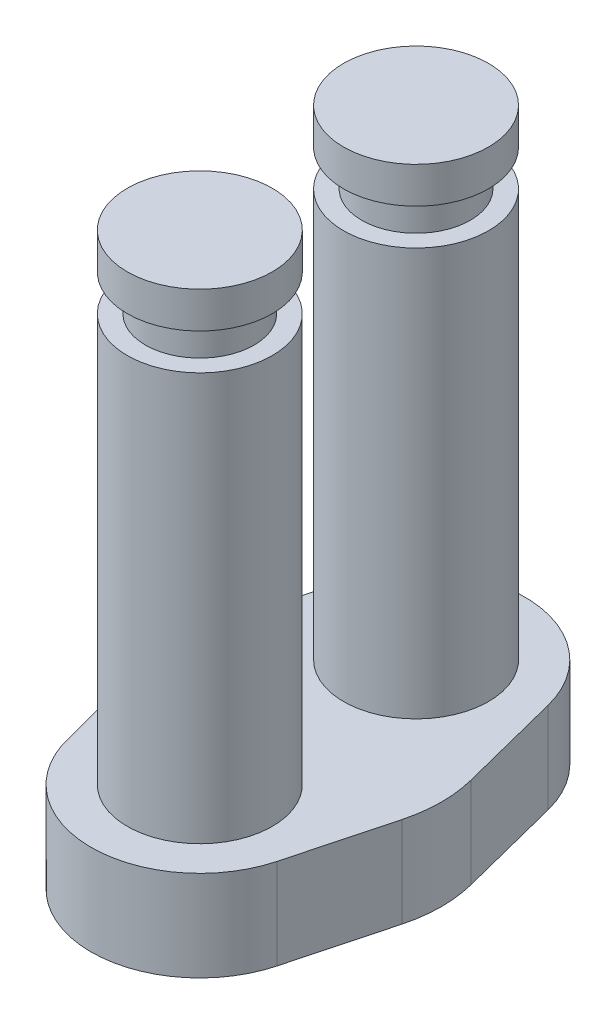
from build123d import *

# Parameters (mm, degrees)
BOSS_EXTRUDE2_DEPTH            = 5
SKETCH3_R                      = 4
BOSS_EXTRUDE3_DEPTH            = 22.5
SKETCH4_R                      = 3
BOSS_EXTRUDE4_DEPTH            = 2
SKETCH5_R                      = 4
BOSS_EXTRUDE5_DEPTH            = 2
SKETCH7_W                      = 1.89865
SKETCH7_H                      = 5
F_6_CLEARANCE_HOLE1_AT_2_COUNT = 2
F_6_CLEARANCE_HOLE1_AT_2_PITCH = 11.930689284


with BuildPart() as part:
    # Sketch2 → Boss-Extrude2 (new body)
    with BuildSketch(Plane(origin=(0, 0, 0), x_dir=(1, 0, 0), z_dir=(0, 1, 0))):
        with BuildLine():
            Line((-3.493426606, -1.944934706), (-1.921673483, -7.798539123))
            ThreePointArc((-1.921673483, -7.798539123), (3.967844549, -11.837003018), (9.548776015, -7.381801872))
            Line((9.548776015, -7.381801872), (10.998470019, -1.926053578))
            ThreePointArc((10.998470019, -1.926053578), (11.24988985, -0.04064778), (11.018921171, 1.84737246))
            Line((11.018921171, 1.84737246), (9.565136937, 7.567628243))
            ThreePointArc((9.565136937, 7.567628243), (3.75, 12.089730275), (-2.065136937, 7.567628243))
            Line((-2.065136937, 7.567628243), (-3.518921171, 1.84737246))
            ThreePointArc((-3.518921171, 1.84737246), (-3.749830525, -0.050419155), (-3.493426606, -1.944934706))
        make_face()
    extrude(amount=BOSS_EXTRUDE2_DEPTH)

    # Sketch3 → Boss-Extrude3 (add)
    with BuildSketch(Plane(origin=(0, 5, 0), x_dir=(1, 0, 0), z_dir=(0, 1, 0))):
        with Locations((3.75, -5.840959009)):
            Circle(SKETCH3_R)
        with Locations((3.75, 6.089730275)):
            Circle(SKETCH3_R)
    extrude(amount=BOSS_EXTRUDE3_DEPTH)

    # Sketch4 → Boss-Extrude4 (add)
    with BuildSketch(Plane(origin=(0, 27.5, 0), x_dir=(1, 0, 0), z_dir=(0, 1, 0))):
        with Locations((3.75, -5.840959009)):
            Circle(SKETCH4_R)
        with Locations((3.75, 6.089730275)):
            Circle(SKETCH4_R)
    extrude(amount=BOSS_EXTRUDE4_DEPTH)

    # Sketch5 → Boss-Extrude5 (add)
    with BuildSketch(Plane(origin=(0, 29.5, 0), x_dir=(1, 0, 0), z_dir=(0, 1, 0))):
        with Locations((3.75, -5.840959009)):
            Circle(SKETCH5_R)
        with Locations((3.75, 6.089730275)):
            Circle(SKETCH5_R)
    extrude(amount=BOSS_EXTRUDE5_DEPTH)

    # Sketch7 → #6 Clearance Hole1 (revolve, cut)
    with BuildSketch(Plane(origin=(3.75, 5, -6.089730275), x_dir=(0, 0, 1), z_dir=(1, 0, 0))):
        with Locations((0.949325, 2.5)):
            Rectangle(SKETCH7_W, SKETCH7_H)
    f_6_clearance_hole1 = revolve(axis=Axis((3.75, 11.35, -6.089730275), (0, -1, 0)), mode=Mode.SUBTRACT)

    # #6 Clearance Hole1 at 2: #6 Clearance Hole1 ×2
    with Locations(*[(0, 0, i * F_6_CLEARANCE_HOLE1_AT_2_PITCH) for i in range(1, F_6_CLEARANCE_HOLE1_AT_2_COUNT)]):
        add(f_6_clearance_hole1, mode=Mode.SUBTRACT)


solid = part.part
